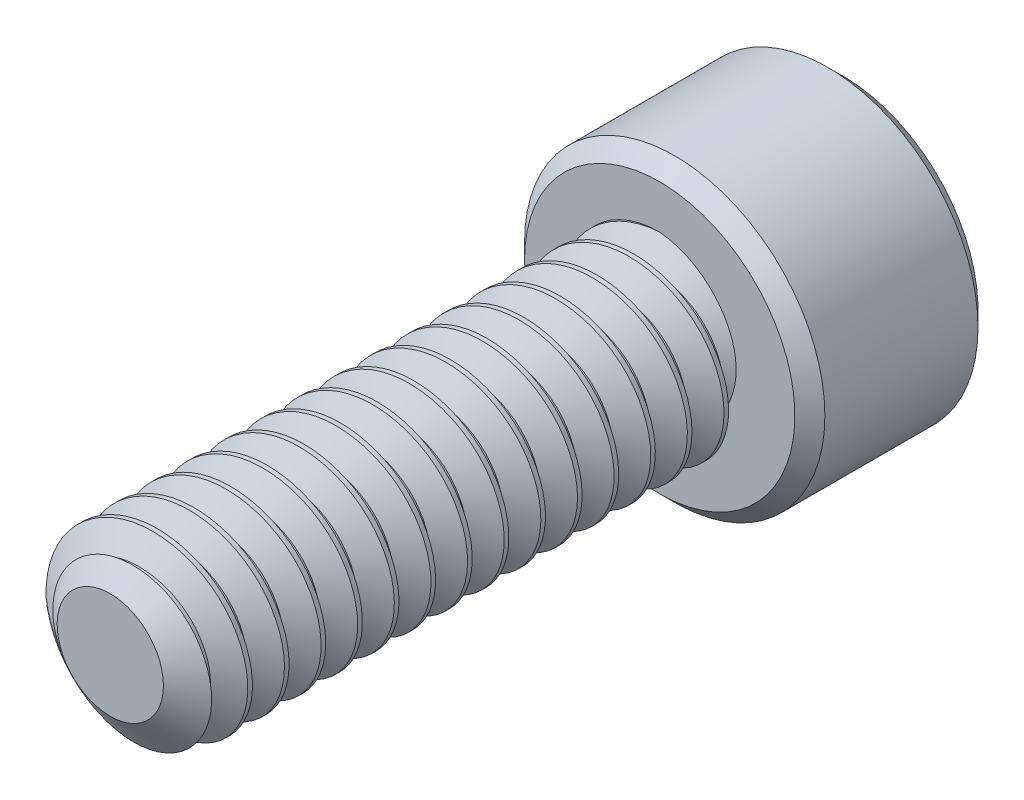
from build123d import *

# Parameters (mm, degrees)
SKETCH1_R          = 1.5875
EXTRUDE1_DEPTH     = 9.525
CUT_SWEEP1_PITCH   = 0.635
SKETCH6_R          = 2.6035
EXTRUDE2_DEPTH     = 3.175
CUT_EXTRUDE1_DEPTH = 1.7859375
CHAMFER1_SIZE      = 0.26035


with BuildPart() as part:
    # Sketch1 → Extrude1 (new body)
    with BuildSketch(Plane.XY):
        Circle(SKETCH1_R)
    extrude(amount=-EXTRUDE1_DEPTH)

    # Cut-Sweep1: the profile of Sketch3 profile screwed along a right-hand helix of 16 turns, 6 arcs to a turn; built about Z, then put on its axis
    cut_sweep1_z = Axis((0, 0, 0), (0, 0, 1))
    cut_sweep1_corners = [(1.5878, 0, -0.555798205), (1.175055401, 0, -0.3175), (1.175055401, 0, -0.238125), (1.5878, 0, 0.000173205)]
    with BuildLine(mode=Mode.PRIVATE) as cut_sweep1_profile:
        Line(cut_sweep1_corners[0], cut_sweep1_corners[1])
        Line(cut_sweep1_corners[1], cut_sweep1_corners[2])
        Line(cut_sweep1_corners[2], cut_sweep1_corners[3])
        Line(cut_sweep1_corners[3], cut_sweep1_corners[0])
    cut_sweep1_cap = Face(cut_sweep1_profile.wire())
    cut_sweep1_turn_angles = [0, 30, 60, 90, 120, 150, 180, 210, 240, 270, 300, 330, 360]
    cut_sweep1_turn_weights = [1, 0.8660254037844387, 1, 0.8660254037844387, 1, 0.8660254037844387, 1, 0.8660254037844387, 1, 0.8660254037844387, 1, 0.8660254037844387, 1]
    cut_sweep1_turn_rails = [Edge.make_bspline([Vector(p[0], p[1], 0).rotate(cut_sweep1_z, cut_sweep1_turn_angles[k]) / cut_sweep1_turn_weights[k] + Vector(0, 0, p[2] + CUT_SWEEP1_PITCH * cut_sweep1_turn_angles[k] / 360) for k in range(13)], [0, 0, 0, 1, 1, 2, 2, 3, 3, 4, 4, 5, 5, 6, 6, 6], 2, cut_sweep1_turn_weights) for p in cut_sweep1_corners]
    cut_sweep1_turn_sides = [Face.make_surface_from_curves(cut_sweep1_turn_rails[p[0]], cut_sweep1_turn_rails[p[1]]) for p in [(0, 1), (1, 2), (2, 3), (3, 0)]]
    cut_sweep1 = Plane(origin=(0, 0, 0), x_dir=(0, 1, 0), z_dir=(0, 0, -1)) * Solid(Shell([*[p.moved(Location((0, 0, CUT_SWEEP1_PITCH * i))) for i in range(16) for p in cut_sweep1_turn_sides], cut_sweep1_cap, cut_sweep1_cap.rotate(cut_sweep1_z, 5760).moved(Location((0, 0, CUT_SWEEP1_PITCH * 5760 / 360)))]))
    add(cut_sweep1, mode=Mode.SUBTRACT)

    # Sketch4 → Cut-Revolve1 (revolve, cut)
    with BuildSketch(Plane(origin=(0, 0, 0), x_dir=(0, 0, -1), z_dir=(1, 0, 0)), mode=Mode.PRIVATE) as cut_revolve1_sk:
        Polygon((0.466649532, 1.5875), (0, 0.921055401), (0, 1.5875), align=None)
    revolve(cut_revolve1_sk.sketch.rotate(Axis((0, 0, 0), (0, 0, -1)), 264.795368264), axis=Axis((0, 0, 0), (0, 0, -1)), mode=Mode.SUBTRACT)

    # Sketch6 → Extrude2 (add)
    with BuildSketch(Plane(origin=(0, 0, -9.525), x_dir=(-1, 0, 0), z_dir=(0, 0, -1))):
        Circle(SKETCH6_R)
    extrude(amount=EXTRUDE2_DEPTH)

    # Sketch7 → Cut-Extrude1 (cut)
    with BuildSketch(Plane(origin=(0, 0, -12.7), x_dir=(-1, 0, 0), z_dir=(0, 0, -1))):
        Polygon((0, 1.374815329), (-1.190625, 0.687407664), (-1.190625, -0.687407664), (0, -1.374815329), (1.190625, -0.687407664), (1.190625, 0.687407664), align=None)
    extrude(amount=-CUT_EXTRUDE1_DEPTH, mode=Mode.SUBTRACT)

    # Cut-Extrude2 cone 1 section (through the dimple's axis) → Cut-Extrude2 (revolve, cut)
    with BuildSketch(Plane(origin=(0, 0, -12.7), x_dir=(0, 1, 0), z_dir=(1, 0, 0))):
        Polygon((0, 0), (1.374815329, 0), (0, 1.374815329), align=None)
    revolve(axis=Axis((0, 0, -12.7), (0, 0, 1)), mode=Mode.SUBTRACT)

    # Chamfer1
    chamfer1_edges = [part.edges().sort_by_distance(p)[0] for p in [
        (2.6035, 0, -9.525),
        (2.6035, 0, -12.7),
    ]]
    chamfer(chamfer1_edges, length=CHAMFER1_SIZE)


solid = part.part
